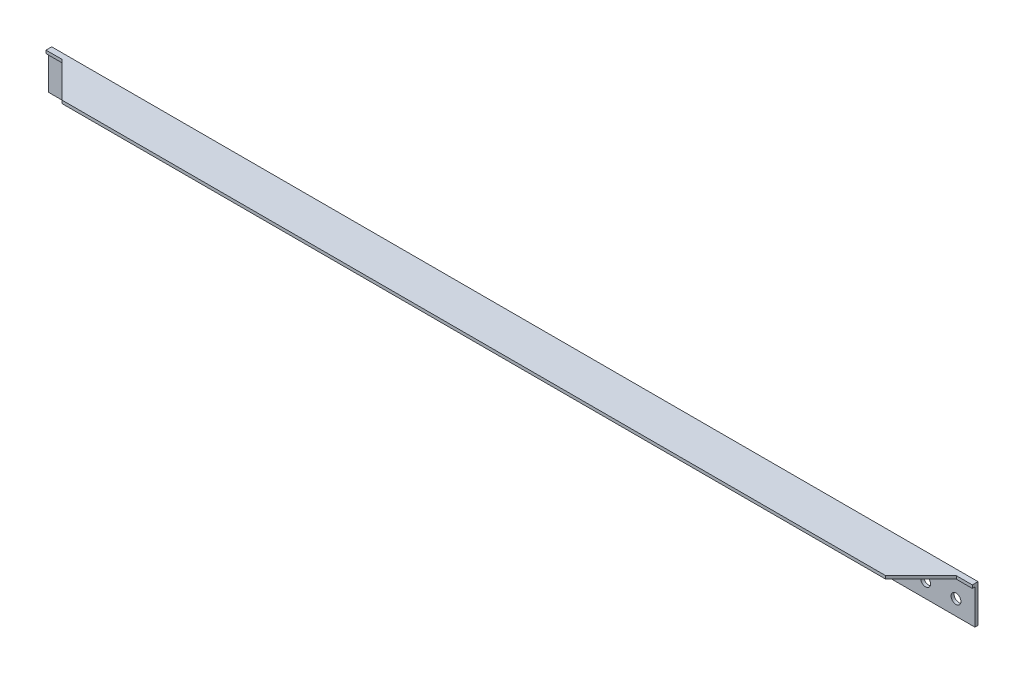
from build123d import *

# Parameters (mm, degrees)
SKETCH_1_W          = 2440
SKETCH_1_H          = 100
SKETCH_1_R          = 13
EXTRUDE_692_DEPTH   = 8
SKETCH_2_W          = 2440
SKETCH_2_H          = 8
EXTRUDE_1_DEPTH     = 100
CUT_EXTRUDE_1_DEPTH = 1229.846613699


with BuildPart() as part:
    # 草图1 → Extrude 692 (new body)
    with BuildSketch(Plane.XY):
        with Locations((0, 50)):
            Rectangle(SKETCH_1_W, SKETCH_1_H)
        with Locations((1090, 40)):
            Circle(SKETCH_1_R, mode=Mode.SUBTRACT)
        with Locations((1170, 40)):
            Circle(SKETCH_1_R, mode=Mode.SUBTRACT)
        with Locations((-1170, 40)):
            Circle(SKETCH_1_R, mode=Mode.SUBTRACT)
        with Locations((-1090, 40)):
            Circle(SKETCH_1_R, mode=Mode.SUBTRACT)
        with Locations((0, 40)):
            Circle(SKETCH_1_R, mode=Mode.SUBTRACT)
        with Locations((80, 40)):
            Circle(SKETCH_1_R, mode=Mode.SUBTRACT)
        with Locations((160, 40)):
            Circle(SKETCH_1_R, mode=Mode.SUBTRACT)
        with Locations((-160, 40)):
            Circle(SKETCH_1_R, mode=Mode.SUBTRACT)
        with Locations((-80, 40)):
            Circle(SKETCH_1_R, mode=Mode.SUBTRACT)
    extrude(amount=EXTRUDE_692_DEPTH)

    # 草图2 → 凸台-拉伸1 (add)
    with BuildSketch(Plane.XY.offset(8)):
        with Locations((0, 96)):
            Rectangle(SKETCH_2_W, SKETCH_2_H)
    extrude(amount=EXTRUDE_1_DEPTH)

    # 草图3 → 切除-拉伸1 (cut, through all)
    with BuildSketch(Plane(origin=(0, 100, 0), x_dir=(-1, 0, 0), z_dir=(0, 1, 0))):
        Polygon((-1085, 108), (-1178, 15), (-1220, 15), (-1220, 108), align=None)
        Polygon((1220, 15), (1178, 15), (1085, 108), (1220, 108), align=None)
    extrude(amount=-CUT_EXTRUDE_1_DEPTH, mode=Mode.SUBTRACT)


solid = part.part
